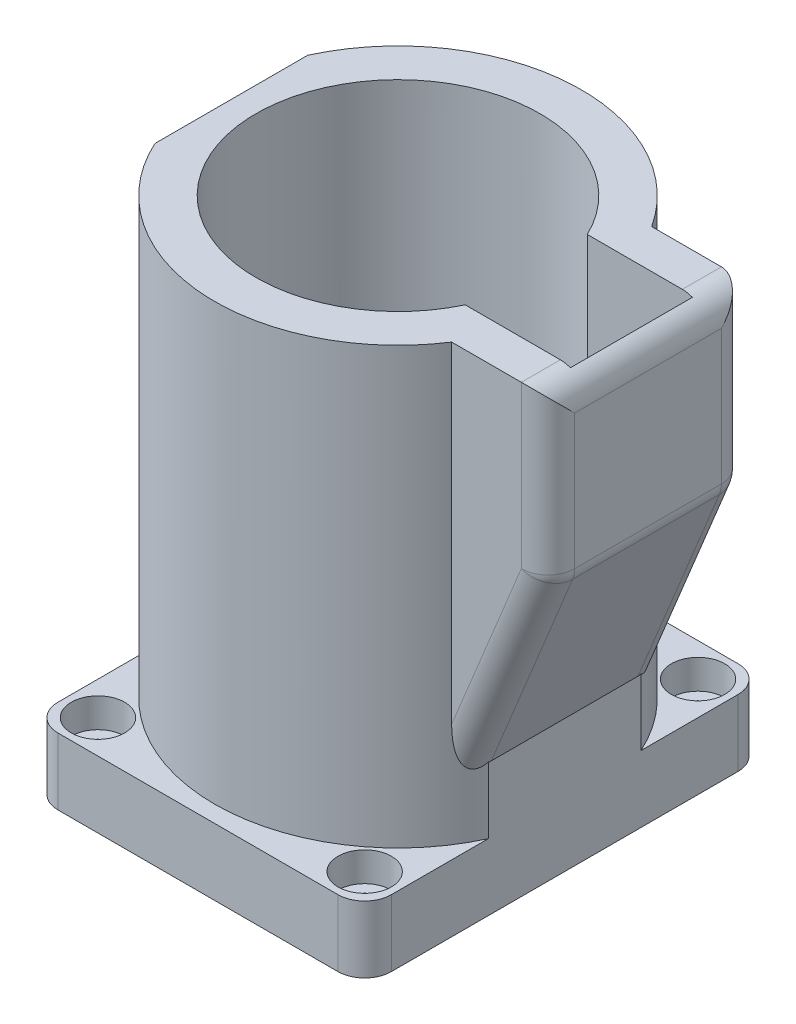
from build123d import *

# Parameters (mm, degrees)
ESQUISSE1_W                                       = 50
ESQUISSE1_H                                       = 60
ESQUISSE1_R                                       = 14.5
BOSS_EXTRU_1_DEPTH                                = 10
ESQUISSE2_R                                       = 21.3
BOSS_EXTRU_2_DEPTH                                = 65.3
BOSS_EXTRU_3_START                                = -25
BOSS_EXTRU_3_DEPTH                                = 25
ENL_V_START                                       = 22
ENL_V_MAT_EXTRU_1_DEPTH                           = 22
CHAMBRAGE_POUR_VIS_SIX_PANS_CREUX_M41_D           = 4.5
CHAMBRAGE_POUR_VIS_SIX_PANS_CREUX_M41_CBORE_D     = 8
CHAMBRAGE_POUR_VIS_SIX_PANS_CREUX_M41_CBORE_DEPTH = 4.4
CHAMBRAGE_POUR_VIS_SIX_PANS_CREUX_M42_D           = 4.8
CHAMBRAGE_POUR_VIS_SIX_PANS_CREUX_M42_CBORE_D     = 8
CHAMBRAGE_POUR_VIS_SIX_PANS_CREUX_M42_CBORE_DEPTH = 4.4
BOSS_EXTRU_4_DEPTH                                = 30
CONG_1_R                                          = 4
CONG_2_R                                          = 4


with BuildPart() as part:
    # Esquisse1 → Boss.-Extru.1 (new body)
    with BuildSketch(Plane(origin=(0, 0, 0), x_dir=(1, 0, 0), z_dir=(0, 1, 0))):
        with Locations((25, 30)):
            Rectangle(ESQUISSE1_W, ESQUISSE1_H)
        with Locations(Location((25, 30, 0), (0, 0, 270))):
            Circle(ESQUISSE1_R, mode=Mode.SUBTRACT)
    extrude(amount=BOSS_EXTRU_1_DEPTH)

    # Esquisse2 → Boss.-Extru.2 (add)
    with BuildSketch(Plane(origin=(0, 10, 0), x_dir=(1, 0, 0), z_dir=(0, 1, 0))):
        with BuildLine():
            ThreePointArc((50, 41.456439237), (25, 57.5), (0, 41.456439237))
            Line((0, 41.456439237), (0, 18.543560763))
            ThreePointArc((0, 18.543560763), (25, 2.5), (50, 18.543560763))
            Line((50, 18.543560763), (50, 41.456439237))
        make_face()
        with Locations(Location((25, 30, 0), (0, 0, 270))):
            Circle(ESQUISSE2_R, mode=Mode.SUBTRACT)
    extrude(amount=BOSS_EXTRU_2_DEPTH)

    # Esquisse3 → Boss.-Extru.3 (add)
    with BuildSketch(Plane(origin=(0, 75.3, 0), x_dir=(1, 0, 0), z_dir=(0, 1, 0)).offset(BOSS_EXTRU_3_START)):
        with BuildLine():
            ThreePointArc((50, 18.543560763), (49.08967559, 16.735855475), (48.048861143, 15))
            Line((48.048861143, 15), (62.5, 15))
            Line((62.5, 15), (62.5, 45))
            Line((62.5, 45), (48.048861143, 45))
            ThreePointArc((48.048861143, 45), (49.08967559, 43.264144525), (50, 41.456439237))
            ThreePointArc((50, 41.456439237), (51.867731575, 35.8630197), (52.5, 30))
            ThreePointArc((52.5, 30), (51.867731575, 24.1369803), (50, 18.543560763))
        make_face()
        with BuildLine():
            Line((50, 41.456439237), (50, 18.543560763))
            ThreePointArc((50, 18.543560763), (51.867731575, 24.1369803), (52.5, 30))
            ThreePointArc((52.5, 30), (51.867731575, 35.8630197), (50, 41.456439237))
        make_face()
    extrude(amount=BOSS_EXTRU_3_DEPTH)

    # Esquisse4 → Enlèv. mat.-Extru.1 (cut)
    with BuildSketch(Plane(origin=(0, 75.3, -75.3), x_dir=(1, 0, 0), z_dir=(0, -1, 0)).offset(ENL_V_START)):
        with BuildLine():
            ThreePointArc((46.3, 45.3), (45.777219327, 40.609887311), (44.234539246, 36.15))
            Line((44.234539246, 36.15), (60, 36.15))
            Line((60, 36.15), (60, 54.45))
            Line((60, 54.45), (44.234539246, 54.45))
            ThreePointArc((44.234539246, 54.45), (45.777219327, 49.990112689), (46.3, 45.3))
        make_face()
    extrude(amount=-ENL_V_MAT_EXTRU_1_DEPTH, mode=Mode.SUBTRACT)

    # Chambrage pour vis à six pans creux M41 (through all)
    with Locations(Plane(origin=(5, 10, -55), x_dir=(0, 0, 1), z_dir=(0, 1, 0))):
        with Locations((0, 0), (0, 40), (50, 40), (50, 0)):
            CounterBoreHole(CHAMBRAGE_POUR_VIS_SIX_PANS_CREUX_M41_D / 2, CHAMBRAGE_POUR_VIS_SIX_PANS_CREUX_M41_CBORE_D / 2, CHAMBRAGE_POUR_VIS_SIX_PANS_CREUX_M41_CBORE_DEPTH)

    # Chambrage pour vis à six pans creux M42 (through all)
    with Locations(Plane(origin=(25, 0, -12.5), x_dir=(0, 0, -1), z_dir=(0, -1, 0))):
        with Locations((0, 0), (17.5, 17.5), (35, 0), (17.5, -17.5)):
            CounterBoreHole(CHAMBRAGE_POUR_VIS_SIX_PANS_CREUX_M42_D / 2, CHAMBRAGE_POUR_VIS_SIX_PANS_CREUX_M42_CBORE_D / 2, CHAMBRAGE_POUR_VIS_SIX_PANS_CREUX_M42_CBORE_DEPTH)

    # Esquisse11 → Boss.-Extru.4 (add)
    with BuildSketch(Plane.XY.offset(-15)):
        Polygon((48.048861143, 50.3), (48.048861143, 15.134837214), (62.5, 50.3), align=None)
    extrude(amount=-BOSS_EXTRU_4_DEPTH)

    # Congé1
    cong_1_edges = [part.edges().sort_by_distance(p)[0] for p in [
        (0, 5, -60),
        (50, 5, -60),
        (50, 5, 0),
        (0, 5, 0),
    ]]
    fillet(cong_1_edges, radius=CONG_1_R)

    # Congé2
    # the kernel refuses this fillet: 4 mm, written as the material it takes off along each edge
    with BuildSketch(Plane(origin=(58.5, 51.089853485, -41), x_dir=(1, 0, 0), z_dir=(0, 0, -1))) as cong_2_piece_1_section:
        Polygon((0, 0), (CONG_2_R, 0), (CONG_2_R, CONG_2_R * 0.197463371222), (CONG_2_R * 0.924943038794, CONG_2_R * 0.38010574185), align=None)
    cong_2_piece_1 = extrude(amount=CONG_2_R, mode=Mode.PRIVATE)
    cong_2_piece_1 = cong_2_piece_1 - Plane(origin=(58.5, 51.089853485, -41), x_dir=(-0.9810563283506197, 0.19372268995448388, 0), z_dir=(0, 0, -1)) * Sphere(CONG_2_R, mode=Mode.PRIVATE)
    add(cong_2_piece_1, mode=Mode.SUBTRACT)
    with BuildSketch(Plane(origin=(58.5, 51.089853485, -19), x_dir=(1, 0, 0), z_dir=(0, 0, 1))) as cong_2_piece_2_section:
        Polygon((0, 0), (CONG_2_R, 0), (CONG_2_R, -CONG_2_R * 0.197463371222), (CONG_2_R * 0.924943038794, -CONG_2_R * 0.38010574185), align=None)
    cong_2_piece_2 = extrude(amount=CONG_2_R, mode=Mode.PRIVATE)
    cong_2_piece_2 = cong_2_piece_2 - Plane(origin=(58.5, 51.089853485, -19), x_dir=(-0.9810563283506197, 0.19372268995448388, 0), z_dir=(0, 0, 1)) * Sphere(CONG_2_R, mode=Mode.PRIVATE)
    add(cong_2_piece_2, mode=Mode.SUBTRACT)
    with BuildSketch(Plane(origin=(62.5, 51.089853485, -45), x_dir=(-1, 0, 0), z_dir=(0, 1, 0))) as cong_2_piece_3:
        with BuildLine():
            CenterArc((CONG_2_R, CONG_2_R), CONG_2_R, 180, 90)
            Line((0, CONG_2_R), (0, 0))
            Line((0, 0), (CONG_2_R, 0))
        make_face()
    extrude(amount=34.210146515, mode=Mode.SUBTRACT)
    with BuildSketch(Plane(origin=(62.5, 50.3, -19), x_dir=(-0.3801057418499003, -0.9249430387935988, 0), z_dir=(0, 0, -1))) as cong_2_piece_4:
        with BuildLine():
            CenterArc((CONG_2_R * 0.197463371222, CONG_2_R), CONG_2_R, 247.659767296, 22.340232704)
            Line((-CONG_2_R * 0.182642370628, CONG_2_R * 0.0750569612064), (0, 0))
            Line((0, 0), (CONG_2_R * 0.197463371222, 0))
        make_face()
    extrude(amount=22, mode=Mode.SUBTRACT)
    with BuildSketch(Plane(origin=(62.5, 51.089853485, -15), x_dir=(-1, 0, 0), z_dir=(0, 1, 0))) as cong_2_piece_5:
        with BuildLine():
            CenterArc((CONG_2_R, -CONG_2_R), CONG_2_R, 90, 90)
            Line((0, -CONG_2_R), (0, 0))
            Line((0, 0), (CONG_2_R, 0))
        make_face()
    extrude(amount=34.210146515, mode=Mode.SUBTRACT)
    with BuildSketch(Plane(origin=(62.5, 75.3, -5), x_dir=(-1, 0, 0), z_dir=(0, 0, -1))) as cong_2_piece_6:
        with BuildLine():
            CenterArc((CONG_2_R, -CONG_2_R), CONG_2_R, 90, 90)
            Line((0, -CONG_2_R), (0, 0))
            Line((0, 0), (CONG_2_R, 0))
        make_face()
    extrude(amount=50, mode=Mode.SUBTRACT)
    with BuildSketch(Plane(origin=(44.247803725, 5.885406826, -45), x_dir=(0, 0, 1), z_dir=(0.38010574184990287, 0.9249430387935978, 0))) as cong_2_piece_7_section:
        with BuildLine():
            CenterArc((CONG_2_R, -CONG_2_R), CONG_2_R, 90, 90)
            Line((0, -CONG_2_R), (0, 0))
            Line((0, 0), (CONG_2_R, 0))
        make_face()
    cong_2_piece_7 = extrude(amount=47.228879898, mode=Mode.PRIVATE)
    cong_2_piece_7 = split(cong_2_piece_7, bisect_by=Plane(origin=(50, 20.820652224, -44.39379807), z_dir=(-1, 0, 0)), keep=Keep.TOP, mode=Mode.PRIVATE)
    cong_2_piece_7 = cong_2_piece_7 - Plane(origin=(25, 20.820652224, -30), x_dir=(0.909090909090922, 0, -0.4165977904505028), z_dir=(0, -1, 0)) * Cylinder(27.5, 111, mode=Mode.PRIVATE)
    add(cong_2_piece_7, mode=Mode.SUBTRACT)
    with BuildSketch(Plane(origin=(44.247803725, 5.885406826, -45), x_dir=(0, 0, 1), z_dir=(0.38010574184990287, 0.9249430387935978, 0))) as cong_2_piece_8_section:
        with BuildLine():
            CenterArc((CONG_2_R, -CONG_2_R), CONG_2_R, 90, 90)
            Line((0, -CONG_2_R), (0, 0))
            Line((0, 0), (CONG_2_R, 0))
        make_face()
    cong_2_piece_8 = extrude(amount=47.228879898, mode=Mode.PRIVATE)
    cong_2_piece_8 = split(cong_2_piece_8, bisect_by=Plane(origin=(50, 19.946502093, -41.15906608), z_dir=(1, 0, 0)), keep=Keep.TOP, mode=Mode.PRIVATE)
    cong_2_piece_8 = cong_2_piece_8 & Plane(origin=(25, 19.946502093, -30), x_dir=(0.909090909090922, 0, -0.4165977904505028), z_dir=(0, -1, 0)) * Cylinder(27.5, 111, mode=Mode.PRIVATE)
    add(cong_2_piece_8, mode=Mode.SUBTRACT)
    with BuildSketch(Plane(origin=(44.247803725, 5.885406826, -45), x_dir=(0, 0, 1), z_dir=(0.38010574184990287, 0.9249430387935978, 0))) as cong_2_piece_9_section:
        with BuildLine():
            CenterArc((CONG_2_R, -CONG_2_R), CONG_2_R, 90, 90)
            Line((0, -CONG_2_R), (0, 0))
            Line((0, 0), (CONG_2_R, 0))
        make_face()
    cong_2_piece_9 = extrude(amount=47.228879898, mode=Mode.PRIVATE)
    cong_2_piece_9 = split(cong_2_piece_9, bisect_by=Plane(origin=(50, 35.999636331, -44.058905406), z_dir=(1, 0, 0)), keep=Keep.TOP, mode=Mode.PRIVATE)
    cong_2_piece_9 = cong_2_piece_9 - Plane(origin=(25, 35.999636331, -30), x_dir=(0.909090909090922, 0, -0.4165977904505028), z_dir=(0, -1, 0)) * Cylinder(27.5, 111, mode=Mode.PRIVATE)
    add(cong_2_piece_9, mode=Mode.SUBTRACT)
    with BuildSketch(Plane(origin=(44.247803725, 5.885406826, -15), x_dir=(0, 0, -1), z_dir=(0.38010574184990287, 0.9249430387935978, 0))) as cong_2_piece_10_section:
        with BuildLine():
            CenterArc((CONG_2_R, CONG_2_R), CONG_2_R, 180, 90)
            Line((0, CONG_2_R), (0, 0))
            Line((0, 0), (CONG_2_R, 0))
        make_face()
    cong_2_piece_10 = extrude(amount=47.228879898, mode=Mode.PRIVATE)
    cong_2_piece_10 = split(cong_2_piece_10, bisect_by=Plane(origin=(50, 20.820650569, -15.60620042), z_dir=(-1, 0, 0)), keep=Keep.TOP, mode=Mode.PRIVATE)
    cong_2_piece_10 = cong_2_piece_10 - Plane(origin=(25, 20.820650569, -30), x_dir=(-0.9090909090909031, 0, 0.4165977904505442), z_dir=(0, -1, 0)) * Cylinder(27.5, 111, mode=Mode.PRIVATE)
    add(cong_2_piece_10, mode=Mode.SUBTRACT)
    with BuildSketch(Plane(origin=(44.247803725, 5.885406826, -15), x_dir=(0, 0, -1), z_dir=(0.38010574184990287, 0.9249430387935978, 0))) as cong_2_piece_11_section:
        with BuildLine():
            CenterArc((CONG_2_R, CONG_2_R), CONG_2_R, 180, 90)
            Line((0, CONG_2_R), (0, 0))
            Line((0, 0), (CONG_2_R, 0))
        make_face()
    cong_2_piece_11 = extrude(amount=47.228879898, mode=Mode.PRIVATE)
    cong_2_piece_11 = split(cong_2_piece_11, bisect_by=Plane(origin=(50, 19.946502096, -18.840933919), z_dir=(1, 0, 0)), keep=Keep.TOP, mode=Mode.PRIVATE)
    cong_2_piece_11 = cong_2_piece_11 & Plane(origin=(25, 19.946502096, -30), x_dir=(-0.9090909090909031, 0, 0.4165977904505442), z_dir=(0, -1, 0)) * Cylinder(27.5, 111, mode=Mode.PRIVATE)
    add(cong_2_piece_11, mode=Mode.SUBTRACT)
    with BuildSketch(Plane(origin=(44.247803725, 5.885406826, -15), x_dir=(0, 0, -1), z_dir=(0.38010574184990287, 0.9249430387935978, 0))) as cong_2_piece_12_section:
        with BuildLine():
            CenterArc((CONG_2_R, CONG_2_R), CONG_2_R, 180, 90)
            Line((0, CONG_2_R), (0, 0))
            Line((0, 0), (CONG_2_R, 0))
        make_face()
    cong_2_piece_12 = extrude(amount=47.228879898, mode=Mode.PRIVATE)
    cong_2_piece_12 = split(cong_2_piece_12, bisect_by=Plane(origin=(50, 35.999636337, -15.941094594), z_dir=(1, 0, 0)), keep=Keep.TOP, mode=Mode.PRIVATE)
    cong_2_piece_12 = cong_2_piece_12 - Plane(origin=(25, 35.999636337, -30), x_dir=(-0.9090909090909031, 0, 0.4165977904505442), z_dir=(0, -1, 0)) * Cylinder(27.5, 111, mode=Mode.PRIVATE)
    add(cong_2_piece_12, mode=Mode.SUBTRACT)


solid = part.part
